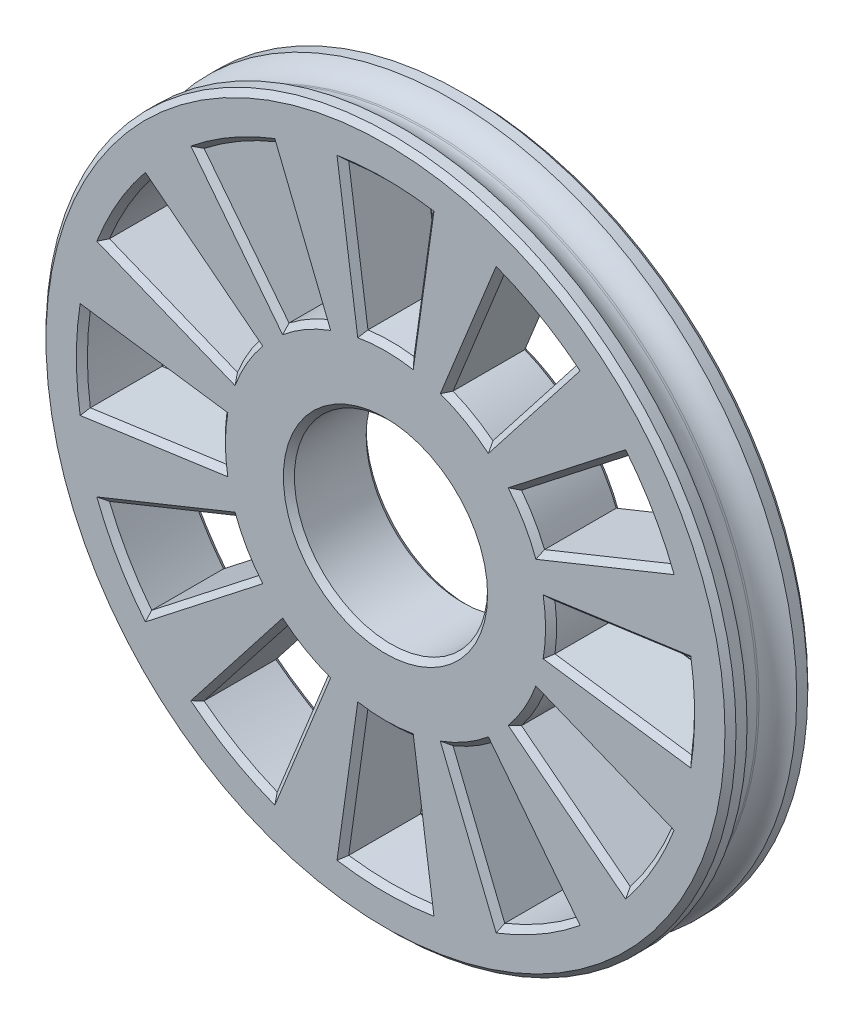
from build123d import *

# Parameters (mm, degrees)
SKETCH1_R           = 12.5
BOSS_EXTRUDE1_DEPTH = 0.6
SKETCH2_R           = 12
BOSS_EXTRUDE2_DEPTH = 1.8
SKETCH3_R           = 12.5
BOSS_EXTRUDE3_DEPTH = 0.6
SKETCH4_R           = 3.4999999999999996
CUT_EXTRUDE1_DEPTH  = 10
FILLET1_R           = 1
CUT_EXTRUDE2_DEPTH  = 5
CHAMFER_1_SIZE      = 0.2


with BuildPart() as part:
    # Sketch1 → Boss-Extrude1 (new body)
    with BuildSketch(Plane.XY):
        Circle(SKETCH1_R)
    extrude(amount=BOSS_EXTRUDE1_DEPTH)

    # Sketch2 → Boss-Extrude2 (add)
    with BuildSketch(Plane.XY.offset(0.6)):
        Circle(SKETCH2_R)
    extrude(amount=BOSS_EXTRUDE2_DEPTH)

    # Sketch3 → Boss-Extrude3 (add)
    with BuildSketch(Plane.XY.offset(2.4)):
        Circle(SKETCH3_R)
    extrude(amount=BOSS_EXTRUDE3_DEPTH)

    # Sketch4 → Cut-Extrude1 (cut)
    with BuildSketch(Plane.XY.offset(2.9999999999999996)):
        Circle(SKETCH4_R)
    extrude(amount=-CUT_EXTRUDE1_DEPTH, mode=Mode.SUBTRACT)

    # Fillet1
    # the kernel refuses this fillet: 1 mm, written as the material it adds along each edge
    with BuildSketch(Plane(origin=(0, 0, 0.6), x_dir=(1, 0, 0), z_dir=(0, -1, 0))) as fillet1_piece_1:
        with BuildLine():
            CenterArc((13, 0.8660254037844873), FILLET1_R, 180, 60.00000000000142)
            Line((12.500000000000021, 3.653e-14), (12.490000000000022, -0.01732050807565244))
            ThreePointArc((12.490000000000022, -0.01732050807565244), (12.25000000000001, -0.02000000000000002), (12, -0.02000000000000002))
            Line((12, -0.02000000000000002), (11.98, 0))
            Line((11.98, 0), (11.98, 0.8660254037844873))
            Line((11.98, 0.8660254037844873), (12, 0.8660254037844873))
        make_face()
    revolve(axis=Axis((0, 0, 0.6), (0, 0, 1)))
    with BuildSketch(Plane(origin=(0, 0, 2.4), x_dir=(1, 0, 0), z_dir=(0, -1, 0))) as fillet1_piece_2:
        with BuildLine():
            CenterArc((13, -0.8660254037844872), FILLET1_R, 119.9999999999986, 60.00000000000141)
            Line((12, -0.8660254037844872), (11.98, -0.8660254037844872))
            Line((11.98, -0.8660254037844872), (11.98, 0))
            Line((11.98, 0), (12, 0.02000000000000002))
            ThreePointArc((12, 0.02000000000000002), (12.25000000000001, 0.02000000000000002), (12.490000000000022, 0.01732050807565244))
            Line((12.490000000000022, 0.01732050807565244), (12.500000000000021, -3.642e-14))
        make_face()
    revolve(axis=Axis((0, 0, 2.4), (0, 0, 1)))

    # Sketch6 → Cut-Extrude2 (cut)
    with BuildSketch(Plane.XY.offset(2.9999999999999996)):
        with BuildLine():
            ThreePointArc((-5.941608412449436, -0.8350386057602955), (-5.985384301558949, -0.41853884246470385), (-6.000000000000001, 7.3e-16))
            Line((-6.000000000000001, 0), (-11.000000000000002, 0))
            ThreePointArc((-11.000000000000002, 1.35e-15), (-10.973204552858066, -0.7673212111854268), (-10.892948756157262, -1.5309041105608177))
            Line((-10.892948756157272, -1.530904110560744), (-5.941608412449422, -0.8350386057604059))
        make_face()
        with BuildLine():
            Line((-11.000000000000002, 0), (-6.000000000000001, 0))
            ThreePointArc((-6.000000000000001, 7.3e-16), (-5.985384301558949, 0.41853884246470535), (-5.941608412449436, 0.8350386057603023))
            Line((-5.941608412449419, 0.8350386057604124), (-10.892948756157269, 1.5309041105607564))
            ThreePointArc((-10.892948756157258, 1.5309041105608348), (-10.973204552858064, 0.7673212111854394), (-11.000000000000002, 1.35e-15))
        make_face()
        with BuildLine():
            ThreePointArc((-5.563103127400742, 2.247639560495432), (-5.196152422706635, 2.999999999999998), (-4.7280645216403085, 3.69396885195398))
            Line((-4.728064521640281, 3.693968851954016), (-8.668118289673847, 6.772276228582362))
            ThreePointArc((-8.668118289673703, 6.772276228582547), (-9.526279441628683, 5.5000000000002505), (-10.199022400234595, 4.120672527575203))
            Line((-10.19902240023464, 4.120672527575111), (-5.563103127400712, 2.247639560495515))
        make_face()
        with BuildLine():
            ThreePointArc((-3.6939688519538363, 4.728064521640421), (-2.9999999999998446, 5.196152422706723), (-2.2476395604952737, 5.563103127400805))
            Line((-2.247639560495355, 5.563103127400771), (-4.1206725275748175, 10.199022400234748))
            ThreePointArc((-4.120672527574913, 10.19902240023471), (-5.499999999999961, 9.52627944162885), (-6.772276228582269, 8.668118289673922))
            Line((-6.772276228582104, 8.668118289674057), (-3.693968851953874, 4.728064521640394))
        make_face()
        with BuildLine():
            ThreePointArc((-0.8350386057601588, 5.9416084124494555), (1.3093e-13, 6.000000000000001), (0.8350386057604194, 5.941608412449419))
            Line((0.8350386057605265, 5.941608412449404), (1.5309041105609653, 10.89294875615724))
            ThreePointArc((1.5309041105610446, 10.89294875615723), (2.3515e-13, 11.000000000000002), (-1.5309041105605765, 10.892948756157296))
            Line((-1.530904110560496, 10.892948756157306), (-0.8350386057602702, 5.941608412449438))
        make_face()
        with BuildLine():
            ThreePointArc((2.2476395604954944, 5.5631031274007166), (3.0000000000000377, 5.196152422706611), (3.6939688519539997, 4.728064521640294))
            Line((3.693968851954033, 4.728064521640266), (6.772276228582394, 8.66811828967382))
            ThreePointArc((6.772276228582579, 8.66811828967368), (5.500000000000321, 9.526279441628642), (4.120672527575322, 10.199022400234545))
            Line((4.120672527575226, 10.199022400234584), (2.247639560495579, 5.563103127400685))
        make_face()
        with BuildLine():
            ThreePointArc((4.7280645216404045, 3.6939688519538576), (5.196152422706697, 2.9999999999998894), (5.563103127400777, 2.2476395604953434))
            Line((5.563103127400745, 2.247639560495427), (10.199022400234698, 4.120672527574949))
            ThreePointArc((10.199022400234659, 4.120672527575043), (9.526279441628803, 5.500000000000041), (8.668118289673892, 6.772276228582307))
            Line((8.668118289674029, 6.772276228582137), (4.728064521640378, 3.6939688519538922))
        make_face()
        with BuildLine():
            ThreePointArc((6.000000000000001, -1.47e-15), (5.985384301558951, -0.41853884246468476), (5.941608412449442, -0.8350386057602529))
            Line((5.941608412449424, -0.8350386057603743), (10.89294875615728, -1.5309041105606864))
            ThreePointArc((10.89294875615726, -1.5309041105608312), (10.973204552858064, -0.767321211185431), (11.000000000000002, -2.69e-15))
            ThreePointArc((11.000000000000002, 0), (10.973204552858064, 0.7673212111854355), (10.89294875615726, 1.5309041105608334))
            Line((10.892948756157278, 1.530904110560695), (5.941608412449424, 0.8350386057603791))
            ThreePointArc((5.941608412449441, 0.8350386057602577), (5.985384301558951, 0.41853884246468387), (6.000000000000001, 0))
        make_face()
        with BuildLine():
            ThreePointArc((5.563103127400779, -2.2476395604953407), (5.196152422706698, -2.9999999999998876), (4.728064521640409, -3.693968851953853))
            Line((4.728064521640386, -3.6939688519538842), (8.668118289674037, -6.772276228582119))
            ThreePointArc((8.66811828967389, -6.772276228582309), (9.5262794416288, -5.500000000000049), (10.199022400234659, -4.120672527575046))
            Line((10.199022400234696, -4.120672527574941), (5.563103127400744, -2.2476395604954225))
        make_face()
        with BuildLine():
            ThreePointArc((3.6939688519540024, -4.728064521640293), (3.000000000000047, -5.196152422706605), (2.2476395604955113, -5.5631031274007094))
            Line((2.2476395604955908, -5.5631031274006775), (4.12067252757525, -10.199022400234576))
            ThreePointArc((4.1206725275753495, -10.199022400234535), (5.500000000000332, -9.526279441628635), (6.772276228582569, -8.668118289673687))
            Line((6.772276228582397, -8.66811828967382), (3.6939688519540343, -4.728064521640265))
        make_face()
        with BuildLine():
            ThreePointArc((0.8350386057604139, -5.94160841244942), (1.3212e-13, -6.000000000000001), (-0.8350386057601523, -5.941608412449456))
            Line((-0.8350386057602597, -5.941608412449441), (-1.5309041105604757, -10.892948756157304))
            ThreePointArc((-1.5309041105605599, -10.892948756157297), (2.3246e-13, -11.000000000000002), (1.53090411056103, -10.892948756157232))
            Line((1.5309041105609575, -10.892948756157244), (0.835038605760522, -5.941608412449403))
        make_face()
        with BuildLine():
            ThreePointArc((-2.2476395604953554, -5.5631031274007725), (-2.9999999999998783, -5.196152422706703), (-3.693968851953832, -4.728064521640426))
            Line((-3.6939688519538656, -4.728064521640402), (-6.7722762285820854, -8.668118289674068))
            ThreePointArc((-6.77227622858227, -8.66811828967392), (-5.50000000000003, -9.526279441628809), (-4.120672527575063, -10.199022400234652))
            Line((-4.1206725275749605, -10.199022400234695), (-2.2476395604954322, -5.5631031274007405))
        make_face()
        with BuildLine():
            ThreePointArc((-4.728064521640322, -3.693968851953964), (-5.196152422706637, -2.999999999999992), (-5.56310312740074, -2.2476395604954376))
            Line((-5.563103127400707, -2.247639560495522), (-10.199022400234629, -4.120672527575124))
            ThreePointArc((-10.19902240023459, -4.120672527575214), (-9.526279441628693, -5.500000000000231), (-8.668118289673735, -6.772276228582507))
            Line((-8.66811828967387, -6.772276228582339), (-4.728064521640293, -3.693968851954003))
        make_face()
    extrude(amount=-CUT_EXTRUDE2_DEPTH, mode=Mode.SUBTRACT)

    # 倒角1
    chamfer_1_edges = [part.edges().sort_by_distance(p)[0] for p in [
        (1.182971358160746, 8.417278584303322, 2.9999999999999996),
        (2.3648e-13, 11, 2.9999999999999996),
        (7.881062763817722, 3.184156044035188, -2.2e-16),
        (5.196152422706697, 2.9999999999998894, 2.9999999999999996),
        (6.698091405657204, 5.233122540268015, 2.9999999999999996),
        (9.526279441628802, 5.500000000000041, 0),
        (5.196152422706696, 2.9999999999998903, 0),
        (6.698091405657204, 5.233122540268015, 0),
        (7.881062763817722, 3.1841560440351877, 2.9999999999999996),
        (9.526279441628802, 5.500000000000041, 2.9999999999999996),
        (5.233122540268215, 6.6980914056570455, -2.2e-16),
        (3.000000000000038, 5.196152422706611, 2.9999999999999996),
        (3.184156044035402, 7.881062763817635, 2.9999999999999996),
        (5.50000000000032, 9.526279441628642, 0),
        (3.0000000000000364, 5.1961524227066125, 0),
        (3.1841560440354026, 7.881062763817635, 0),
        (5.233122540268214, 6.698091405657044, 2.9999999999999996),
        (5.5000000000003215, 9.526279441628642, 2.9999999999999996),
        (8.417278584303354, -1.1829713581605306, -2.2e-16),
        (6.000000000000001, 2.44e-15, 2.9999999999999996),
        (8.41727858430335, 1.182971358160537, 2.9999999999999996),
        (11.000000000000007, 9.912e-14, 0),
        (6, -3.854e-14, 0),
        (8.41727858430335, 1.182971358160537, -2.2e-16),
        (8.417278584303352, -1.1829713581605303, 2.9999999999999996),
        (11, 2.47e-15, 2.9999999999999996),
        (3.1841560440354204, -7.881062763817627, 0),
        (3.000000000000047, -5.196152422706607, 2.9999999999999996),
        (5.233122540268216, -6.698091405657043, 2.9999999999999996),
        (5.500000000000327, -9.526279441628638, 0),
        (3.000000000000046, -5.196152422706607, 0),
        (5.233122540268216, -6.698091405657043, 0),
        (3.1841560440354204, -7.881062763817626, 2.9999999999999996),
        (5.500000000000327, -9.526279441628638, 2.9999999999999996),
        (6.698091405657211, -5.233122540268001, 0),
        (5.1961524227066995, -2.9999999999998854, 2.9999999999999996),
        (7.88106276381772, -3.1841560440351815, 2.9999999999999996),
        (9.5262794416288, -5.500000000000043, 0),
        (5.196152422706697, -2.999999999999887, 0),
        (7.881062763817722, -3.1841560440351824, 0),
        (6.698091405657212, -5.233122540268002, 2.9999999999999996),
        (9.5262794416288, -5.500000000000043, 2.9999999999999996),
        (-3.4999999999999996, 4.3e-16, 0),
        (-1.182971358160368, -8.417278584303375, 0),
        (1.3214e-13, -6.000000000000002, 2.9999999999999996),
        (1.1829713581607397, -8.417278584303324, 2.9999999999999996),
        (2.3753e-13, -11.000000000000002, 0),
        (1.3392e-13, -6.000000000000002, 0),
        (1.1829713581607395, -8.417278584303324, -2.2e-16),
        (-3.4999999999999996, 4.3e-16, 2.9999999999999996),
        (-1.1829713581603678, -8.417278584303373, 2.9999999999999996),
        (2.3753e-13, -11.000000000000002, 2.9999999999999996),
        (-7.881062763817668, -3.1841560440353227, 0),
        (-5.196152422706637, -2.999999999999992, 2.9999999999999996),
        (-6.698091405657082, -5.2331225402681705, 2.9999999999999996),
        (-9.526279441628695, -5.500000000000234, 0),
        (-5.196152422706639, -2.9999999999999902, 0),
        (-6.698091405657081, -5.2331225402681705, 0),
        (-7.881062763817668, -3.1841560440353227, 2.9999999999999996),
        (-9.526279441628695, -5.500000000000232, 2.9999999999999996),
        (-5.233122540267975, -6.698091405657235, 0),
        (-2.999999999999881, -5.196152422706702, 2.9999999999999996),
        (-3.1841560440351966, -7.8810627638177175, 2.9999999999999996),
        (-5.500000000000028, -9.526279441628807, 0),
        (-2.9999999999998828, -5.196152422706701, 0),
        (-3.184156044035196, -7.8810627638177175, 0),
        (-5.233122540267976, -6.698091405657235, 2.9999999999999996),
        (-5.500000000000028, -9.526279441628807, 2.9999999999999996),
        (-12.5, 1.53e-15, 0),
        (-6.000000000000002, 3.21e-15, 2.9999999999999996),
        (-8.417278584303347, -1.182971358160575, 2.9999999999999996),
        (-11.000000000000004, 6.266e-14, 0),
        (-8.417278584303345, 1.1829713581605845, -2.2e-16),
        (-6.000000000000002, 4.56e-14, 0),
        (-8.417278584303348, -1.1829713581605752, -2.2e-16),
        (-8.417278584303343, 1.1829713581605845, 2.9999999999999996),
        (-11.000000000000002, 7.55e-15, 2.9999999999999996),
        (-3.1841560440350873, 7.881062763817763, -2.2e-16),
        (-2.9999999999998455, 5.1961524227067235, 2.9999999999999996),
        (-5.233122540267989, 6.698091405657225, 2.9999999999999996),
        (-5.499999999999961, 9.526279441628851, 0),
        (-2.9999999999998463, 5.1961524227067235, 0),
        (-5.23312254026799, 6.698091405657225, 0),
        (-3.184156044035086, 7.881062763817759, 2.9999999999999996),
        (-5.499999999999961, 9.526279441628851, 2.9999999999999996),
        (-6.698091405657065, 5.233122540268189, -2.2e-16),
        (-5.196152422706634, 2.999999999999998, 2.9999999999999996),
        (-7.881062763817676, 3.184156044035313, 2.9999999999999996),
        (-9.526279441628684, 5.500000000000247, 0),
        (-5.196152422706634, 2.999999999999998, 0),
        (-7.881062763817676, 3.1841560440353125, 0),
        (-6.698091405657064, 5.233122540268189, 2.9999999999999996),
        (-9.526279441628681, 5.500000000000247, 2.9999999999999996),
        (-12.5, 1.53e-15, 3),
        (1.182971358160746, 8.417278584303322, -2.2e-16),
        (1.3195e-13, 6.000000000000001, 2.9999999999999996),
        (-1.1829713581603831, 8.417278584303372, 2.9999999999999996),
        (2.3692e-13, 11, 0),
        (1.3206e-13, 6.000000000000001, 0),
        (-1.1829713581603831, 8.417278584303372, -2.2e-16),
    ]]
    chamfer(chamfer_1_edges, length=CHAMFER_1_SIZE)


solid = part.part
